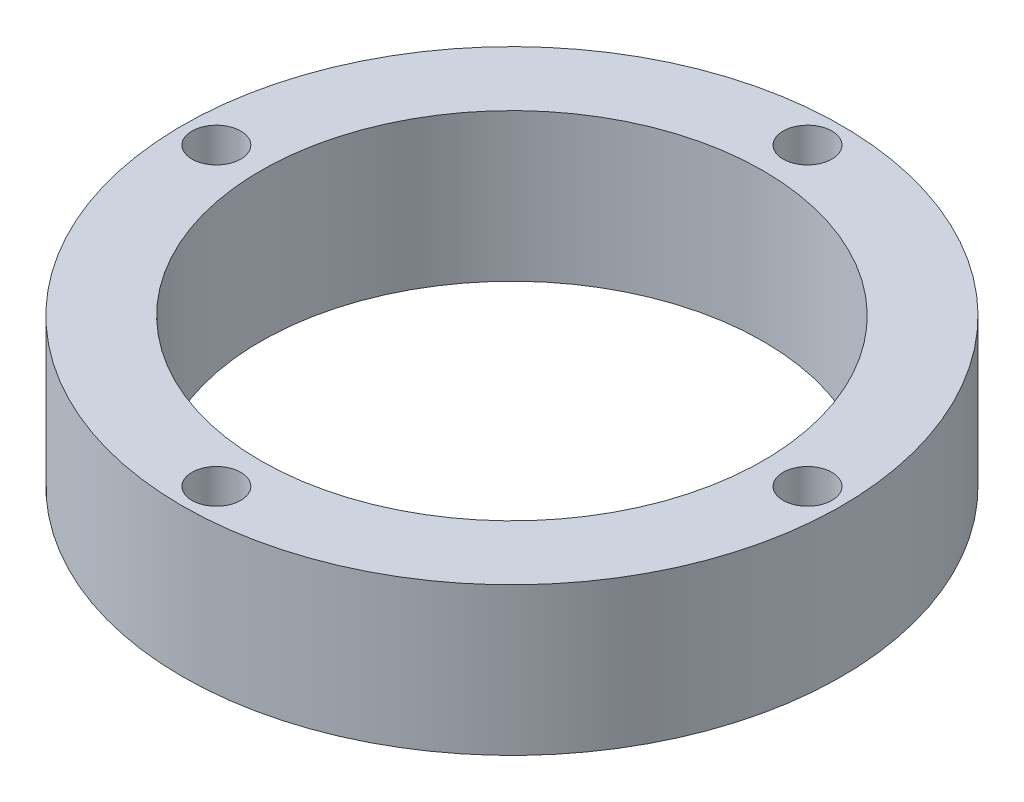
from build123d import *

# Parameters (mm, degrees)
SKETCH1_R           = 22.300536673
SKETCH1_R_2         = 17
BOSS_EXTRUDE1_DEPTH = 10
SKETCH2_R           = 1.65
CUT_EXTRUDE1_DEPTH  = 34.0851609


with BuildPart() as part:
    # Sketch1 → Boss-Extrude1 (new body)
    with BuildSketch(Plane(origin=(0, 0, 0), x_dir=(1, 0, 0), z_dir=(0, 1, 0))):
        Circle(SKETCH1_R)
        Circle(SKETCH1_R_2, mode=Mode.SUBTRACT)
    extrude(amount=BOSS_EXTRUDE1_DEPTH)

    # Sketch2 → Cut-Extrude1 (cut, through all)
    with BuildSketch(Plane(origin=(0, 10, 0), x_dir=(1, 0, 0), z_dir=(0, 1, 0))):
        with Locations((0, 20)):
            Circle(SKETCH2_R)
        with Locations((20, 0)):
            Circle(SKETCH2_R)
        with Locations((0, -20)):
            Circle(SKETCH2_R)
        with Locations((-20, 0)):
            Circle(SKETCH2_R)
    extrude(amount=-CUT_EXTRUDE1_DEPTH, mode=Mode.SUBTRACT)


solid = part.part
